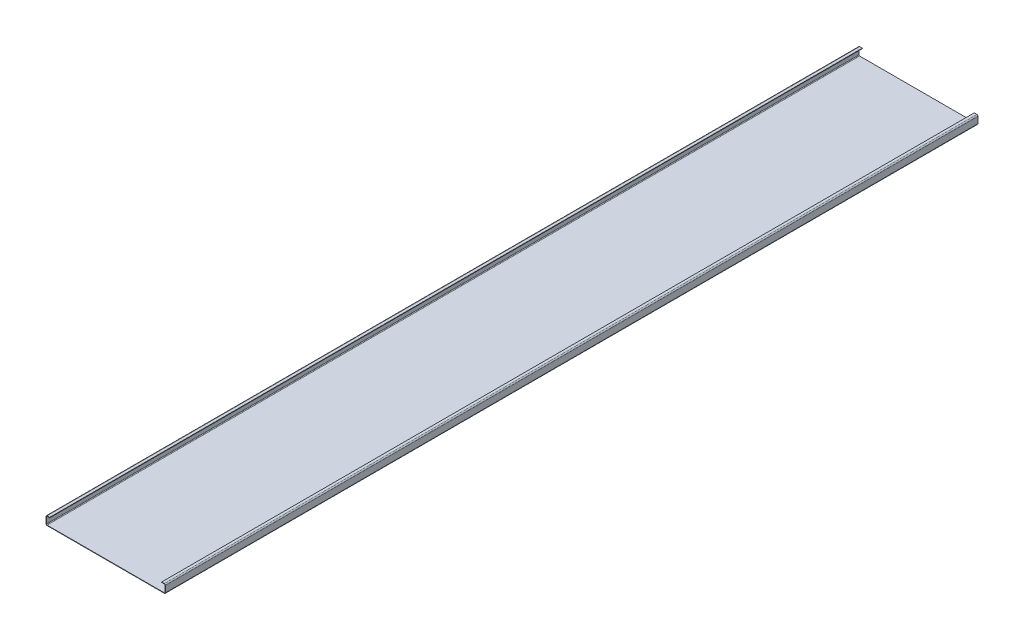
from build123d import *

# Parameters (mm, degrees)
BASE_FLANGE1_DEPTH = 2380


# Sheet-metal steps are written as plain solids
with BuildPart() as part:
    # Sketch1 → Base-Flange1 (new body)
    with BuildSketch(Plane.XY):
        with BuildLine():
            Line((11, 25), (3.25, 25))
            ThreePointArc((3.25, 25), (0.951902961, 24.048097039), (0, 21.75))
            Line((0, 21.75), (0, 3.25))
            ThreePointArc((0, 3.25), (0.951902961, 0.951902961), (3.25, 0))
            Line((3.25, 0), (346.75, 0))
            ThreePointArc((346.75, 0), (349.048097039, 0.951902961), (350, 3.25))
            Line((350, 3.25), (350, 21.75))
            ThreePointArc((350, 21.75), (349.048097039, 24.048097039), (346.75, 25))
            Line((346.75, 25), (339, 25))
            Line((339, 25), (339, 23.75))
            Line((339, 23.75), (346.75, 23.75))
            ThreePointArc((346.75, 23.75), (348.164213562, 23.164213562), (348.75, 21.75))
            Line((348.75, 21.75), (348.75, 3.25))
            ThreePointArc((348.75, 3.25), (348.164213562, 1.835786438), (346.75, 1.25))
            Line((346.75, 1.25), (3.25, 1.25))
            ThreePointArc((3.25, 1.25), (1.835786438, 1.835786438), (1.25, 3.25))
            Line((1.25, 3.25), (1.25, 21.75))
            ThreePointArc((1.25, 21.75), (1.835786438, 23.164213562), (3.25, 23.75))
            Line((3.25, 23.75), (11, 23.75))
            Line((11, 23.75), (11, 25))
        make_face()
    extrude(amount=BASE_FLANGE1_DEPTH)


solid = part.part
